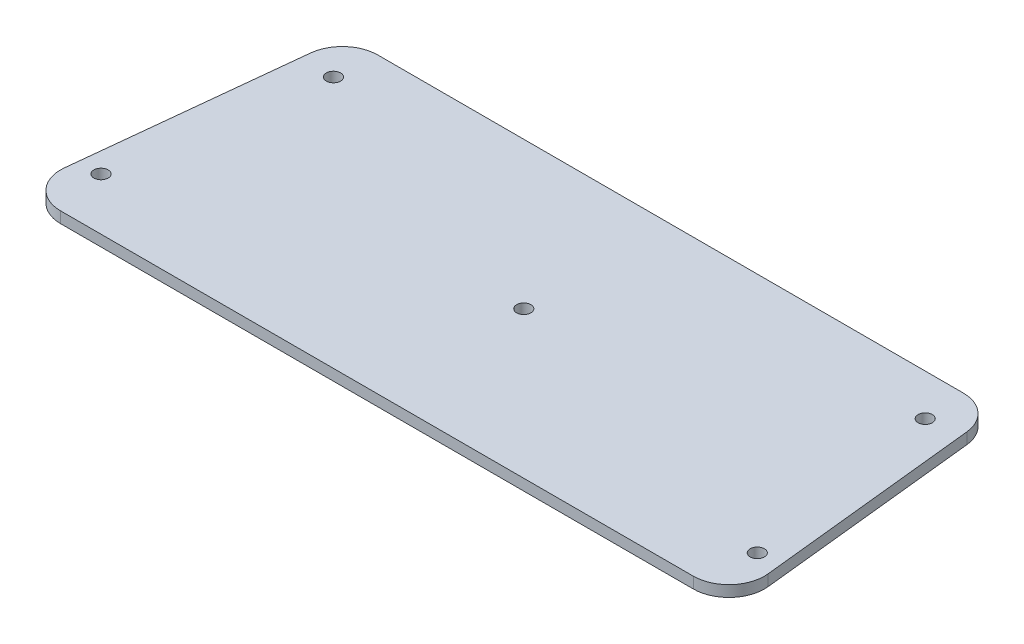
from build123d import *

# Parameters (mm, degrees)
SKETCH1_R           = 2.032
BOSS_EXTRUDE1_DEPTH = 3.175
FILLET1_R           = 10.16
FILLET2_R           = 10.16


with BuildPart() as part:
    # Sketch1 → Boss-Extrude1 (new body)
    with BuildSketch(Plane(origin=(0, 0, 0), x_dir=(1, 0, 0), z_dir=(0, 1, 0))):
        Polygon((-92.71, 41.91), (-101.6, -41.91), (101.6, -41.91), (92.71, 41.91), align=None)
        with Locations((-93.6752, -27.02052)):
            Circle(SKETCH1_R, mode=Mode.SUBTRACT)
        with Locations((93.6752, -27.02052)):
            Circle(SKETCH1_R, mode=Mode.SUBTRACT)
        Circle(SKETCH1_R, mode=Mode.SUBTRACT)
        with Locations((-84.4677, 30.12948)):
            Circle(SKETCH1_R, mode=Mode.SUBTRACT)
        with Locations((84.4677, 30.12948)):
            Circle(SKETCH1_R, mode=Mode.SUBTRACT)
    extrude(amount=BOSS_EXTRUDE1_DEPTH)

    # Fillet1
    fillet1_edges = [part.edges().sort_by_distance(p)[0] for p in [
        (101.6, 1.5875, 41.91),
        (-101.6, 1.5875, 41.91),
    ]]
    fillet(fillet1_edges, radius=FILLET1_R)

    # Fillet2
    fillet2_edges = [part.edges().sort_by_distance(p)[0] for p in [
        (-92.71, 1.5875, -41.91),
        (92.71, 1.5875, -41.91),
    ]]
    fillet(fillet2_edges, radius=FILLET2_R)


solid = part.part
